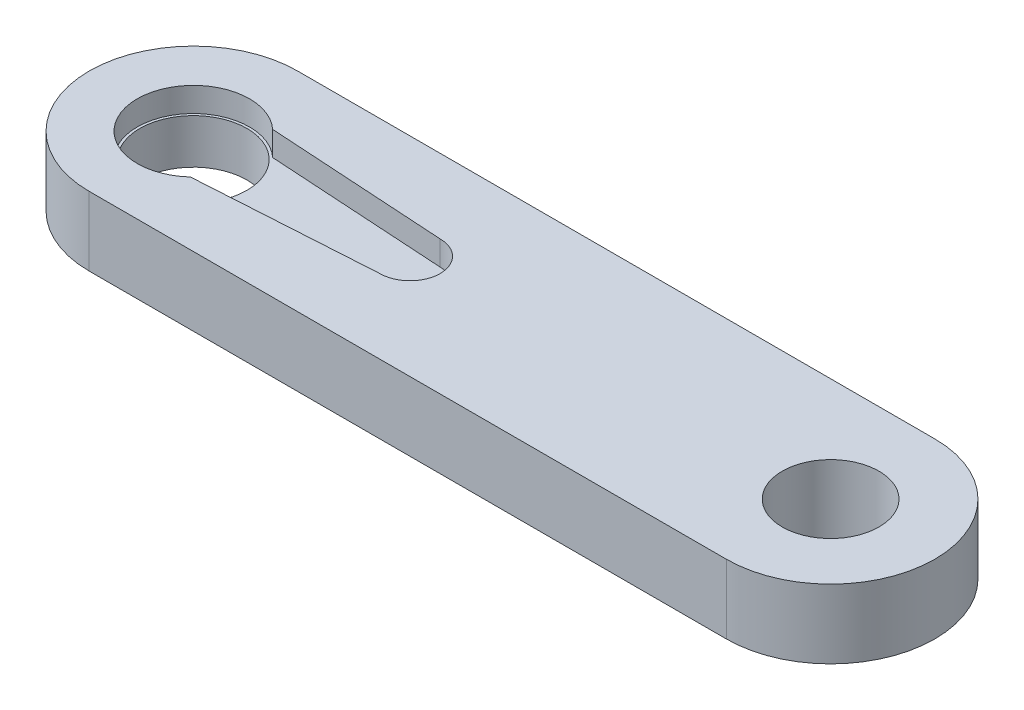
from build123d import *

# Parameters (mm, degrees)
BOSS_EXTRUDE1_DEPTH       = 3
SKETCH2_R                 = 3.6
CUT_EXTRUDE1_DEPTH        = 3.95
BOSS_EXTRUDE2_DEPTH       = 1.64
SKETCH4_R                 = 3.25
CUT_EXTRUDE2_DEPTH        = 4.64
CUT_EXTRUDE3_REACH        = 64.566
SKETCH7_W                 = 12.2
SKETCH7_H                 = 14
BODY_MOVE_COPY1_OUTLINE_R = 3.6
BODY_MOVE_COPY1_DEPTH     = 4.64
BODY_MOVE_COPY1_START     = 3
BODY_MOVE_COPY1_2_DEPTH   = 1.64
BODY_MOVE_COPY1_3_DEPTH   = 4.64
BODY_MOVE_COPY1_4_DEPTH   = 3


# Read off the part's stored shape, not the designer's step: Body-Move/Copy1
with BuildPart() as part:
    # Sketch1 → Boss-Extrude1 (new body)
    with BuildSketch(Plane(origin=(0, 0, 0), x_dir=(1, 0, 0), z_dir=(0, 1, 0))):
        with BuildLine():
            Line((0, 7), (55, 7))
            ThreePointArc((55, 7), (62, 0), (55, -7))
            Line((55, -7), (0, -7))
            ThreePointArc((0, -7), (-7, 0), (0, 7))
        make_face()
    extrude(amount=BOSS_EXTRUDE1_DEPTH)

    # Sketch2 → Cut-Extrude1 (cut)
    with BuildSketch(Plane.XZ):
        with Locations(Location((0, 0, 0), (0, 0, 270))):
            Circle(SKETCH2_R)
    extrude(amount=-CUT_EXTRUDE1_DEPTH, mode=Mode.SUBTRACT)

    # Sketch3 → Boss-Extrude2 (add)
    with BuildSketch(Plane(origin=(0, 3, 0), x_dir=(1, 0, 0), z_dir=(0, 1, 0))):
        with BuildLine():
            Line((0, -7), (55, -7))
            ThreePointArc((55, -7), (62, 0), (55, 7))
            Line((55, 7), (0, 7))
            ThreePointArc((0, 7), (-7, 0), (0, -7))
        make_face()
        with BuildLine():
            Line((14.555396889, 2.01999279), (2.561818442, 2.765860855))
            ThreePointArc((2.561818442, 2.765860855), (-3.77, 0), (2.561818442, -2.765860855))
            Line((2.561818442, -2.765860855), (14.555396889, -2.01999279))
            ThreePointArc((14.555396889, -2.01999279), (16.57, 0), (14.555396889, 2.01999279))
        make_face(mode=Mode.SUBTRACT)
    extrude(amount=BOSS_EXTRUDE2_DEPTH)

    # Sketch4 → Cut-Extrude2 (cut)
    with BuildSketch(Plane(origin=(0, 4.64, 0), x_dir=(1, 0, 0), z_dir=(0, 1, 0))):
        with Locations(Location((55, 0, 0), (0, 0, 270))):
            Circle(SKETCH4_R)
    extrude(amount=-CUT_EXTRUDE2_DEPTH, mode=Mode.SUBTRACT)

    # Sketch7 → Cut-Extrude3 (cut, up to next)
    with BuildSketch(Plane(origin=(0, 4.64, 0), x_dir=(1, 0, 0), z_dir=(0, 1, 0)), mode=Mode.PRIVATE) as cut_extrude3_sk1:
        with Locations((33.6, 0)):
            Rectangle(SKETCH7_W, SKETCH7_H)
    cut_extrude3_tool1 = extrude(cut_extrude3_sk1.sketch, amount=-CUT_EXTRUDE3_REACH, mode=Mode.PRIVATE) & part.part
    add(cut_extrude3_tool1.solids().sort_by_distance((33.6, 4.64, 0))[0], mode=Mode.SUBTRACT)


with BuildPart() as cut_extrude3_piece_1:
    # of the separate pieces the step leaves, piece 1, a body of its own (cut_extrude3_pieces)
    add(part.part.solids().sort_by_distance((0, 0, -7))[0])

    # Body-Move/Copy1 outline → Body-Move/Copy1 (cut)
    # profile 1 of 2: a face of its own
    with BuildSketch(Plane(origin=(0, 0, 0), x_dir=(1, 0, 0), z_dir=(0, 1, 0))):
        with BuildLine():
            Line((0, -7), (12.2, -7))
            ThreePointArc((12.2, -7), (5.2, 0), (12.2, 7))
            Line((12.2, 7), (0, 7))
            ThreePointArc((0, 7), (-7, 0), (0, -7))
        make_face()
        Circle(BODY_MOVE_COPY1_OUTLINE_R, mode=Mode.SUBTRACT)
    # profile 2 of 2: a face of its own
    with BuildSketch(Plane(origin=(0, 0, 0), x_dir=(1, 0, 0), z_dir=(0, 1, 0))):
        with Locations((12.2, 0)):
            Circle(BODY_MOVE_COPY1_OUTLINE_R)
    extrude(amount=BODY_MOVE_COPY1_DEPTH, mode=Mode.SUBTRACT)

    # Body-Move_Copy1 2 outline → Body-Move_Copy1 2 (cut)
    with BuildSketch(Plane(origin=(0, 0, 0), x_dir=(1, 0, 0), z_dir=(0, 1, 0)).offset(BODY_MOVE_COPY1_START)):
        with BuildLine():
            ThreePointArc((26.755396889, -2.01999279), (27.134536032, -1.983061279), (27.5, -1.875606568))
            Line((27.5, -1.875606568), (27.5, 1.875606568))
            ThreePointArc((27.5, 1.875606568), (27.134536032, 1.983061279), (26.755396889, 2.01999279))
            Line((26.755396889, 2.01999279), (14.761818442, 2.765860855))
            ThreePointArc((14.761818442, 2.765860855), (11.91613853, 3.759298161), (9.251901395, 2.349811613))
            Line((9.251901395, 2.349811613), (9.461484137, 2.336777882))
            ThreePointArc((9.461484137, 2.336777882), (12.476666707, 3.58935308), (15.264276596, 1.889499654))
            ThreePointArc((15.264276596, 1.889499654), (16.57, 0), (15.264276596, -1.889499654))
            ThreePointArc((15.264276596, -1.889499654), (12.476666707, -3.58935308), (9.461484137, -2.336777882))
            Line((9.461484137, -2.336777882), (9.251901395, -2.349811613))
            ThreePointArc((9.251901395, -2.349811613), (11.91613853, -3.759298161), (14.761818442, -2.765860855))
            Line((14.761818442, -2.765860855), (26.755396889, -2.01999279))
        make_face()
    extrude(amount=BODY_MOVE_COPY1_2_DEPTH, mode=Mode.SUBTRACT)

    # Body-Move_Copy1 3 outline → Body-Move_Copy1 3 (add)
    with BuildSketch(Plane(origin=(0, 0, 0), x_dir=(1, 0, 0), z_dir=(0, 1, 0))):
        with BuildLine():
            Line((27.5, -7), (39.7, -7))
            Line((39.7, -7), (39.7, 7))
            Line((39.7, 7), (27.5, 7))
            Line((27.5, 7), (27.5, 1.875606568))
            ThreePointArc((27.5, 1.875606568), (28.77, 0), (27.5, -1.875606568))
            Line((27.5, -1.875606568), (27.5, -7))
        make_face()
        with BuildLine():
            ThreePointArc((5.689385292, 2.571360753), (5.2, 0), (5.689385292, -2.571360753))
            Line((5.689385292, -2.571360753), (9.251901395, -2.349811613))
            ThreePointArc((9.251901395, -2.349811613), (8.43, 0), (9.251901395, 2.349811613))
            Line((9.251901395, 2.349811613), (5.689385292, 2.571360753))
        make_face()
    extrude(amount=BODY_MOVE_COPY1_3_DEPTH)

    # Body-Move_Copy1 4 outline → Body-Move_Copy1 4 (add)
    with BuildSketch(Plane(origin=(0, 0, 0), x_dir=(1, 0, 0), z_dir=(0, 1, 0))):
        with BuildLine():
            Line((27.5, 1.875606568), (27.5, -1.875606568))
            ThreePointArc((27.5, -1.875606568), (28.77, 0), (27.5, 1.875606568))
        make_face()
    extrude(amount=BODY_MOVE_COPY1_4_DEPTH)


with BuildPart() as cut_extrude3_piece_2:
    # of the separate pieces the step leaves, piece 2, a body of its own (cut_extrude3_pieces)
    add(part.part.solids().sort_by_distance((39.7, 0, -7))[0])


with BuildPart() as cut_extrude3_piece_1_1:
    add(cut_extrude3_piece_1.part)

    # Combine1: union Cut-Extrude3 piece 2
    add(cut_extrude3_piece_2.part)


solid = cut_extrude3_piece_1_1.part
